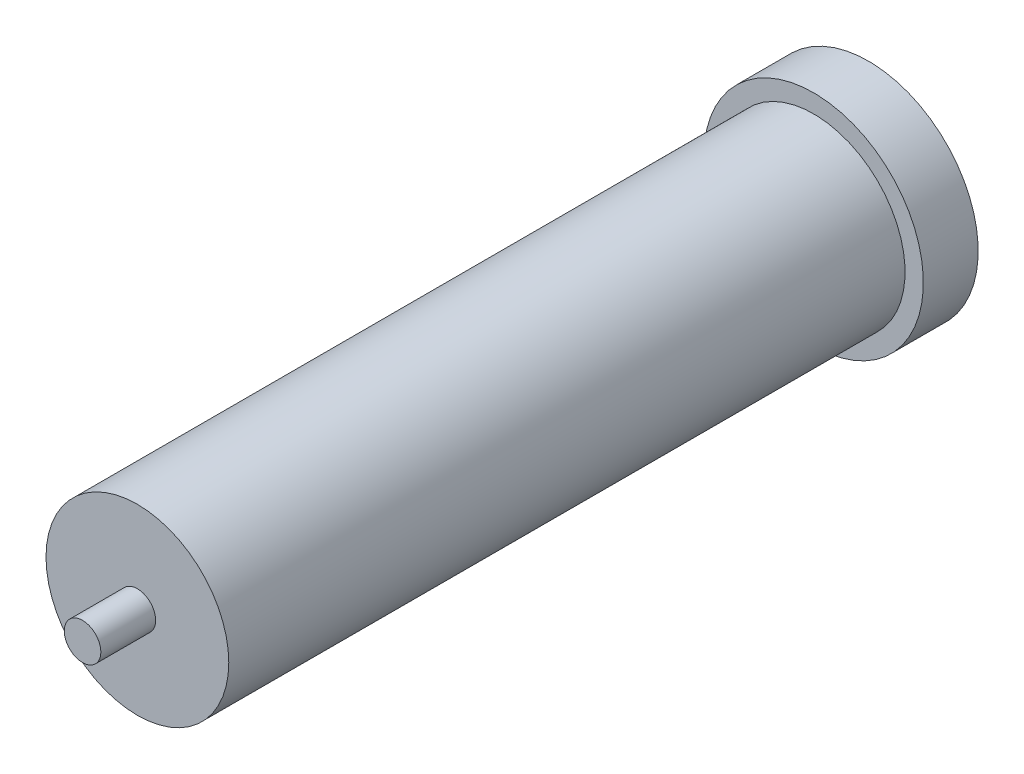
from build123d import *

# Parameters (mm, degrees)
SKETCH_1_R      = 5
EXTRUDE_1_DEPTH = 40
SKETCH_2_R      = 1
EXTRUDE_2_DEPTH = 3
EXTRUDE_START   = 3
SKETCH_4_R      = 1
EXTRUDE_3_DEPTH = 3
SKETCH_6_R      = 6
EXTRUDE_5_DEPTH = 3


with BuildPart() as part:
    # Эскиз1 → Бобышка-Вытянуть1 (new body)
    with BuildSketch(Plane.XY):
        Circle(SKETCH_1_R)
    extrude(amount=EXTRUDE_1_DEPTH)

    # Эскиз2 → Бобышка-Вытянуть2 (add)
    with BuildSketch(Plane.XY.offset(40)):
        Circle(SKETCH_2_R)
    extrude(amount=EXTRUDE_2_DEPTH)

    # Эскиз4 → Бобышка-Вытянуть3 (add)
    with BuildSketch(Plane(origin=(0, 0, 0), x_dir=(-1, 0, 0), z_dir=(0, 0, -1)).offset(EXTRUDE_START)):
        Circle(SKETCH_4_R)
    extrude(amount=-EXTRUDE_3_DEPTH)

    # Эскиз6 → Бобышка-Вытянуть5 (add)
    with BuildSketch(Plane(origin=(0, 0, 0), x_dir=(-1, 0, 0), z_dir=(0, 0, -1))):
        Circle(SKETCH_6_R)
    extrude(amount=-EXTRUDE_5_DEPTH)


solid = part.part
